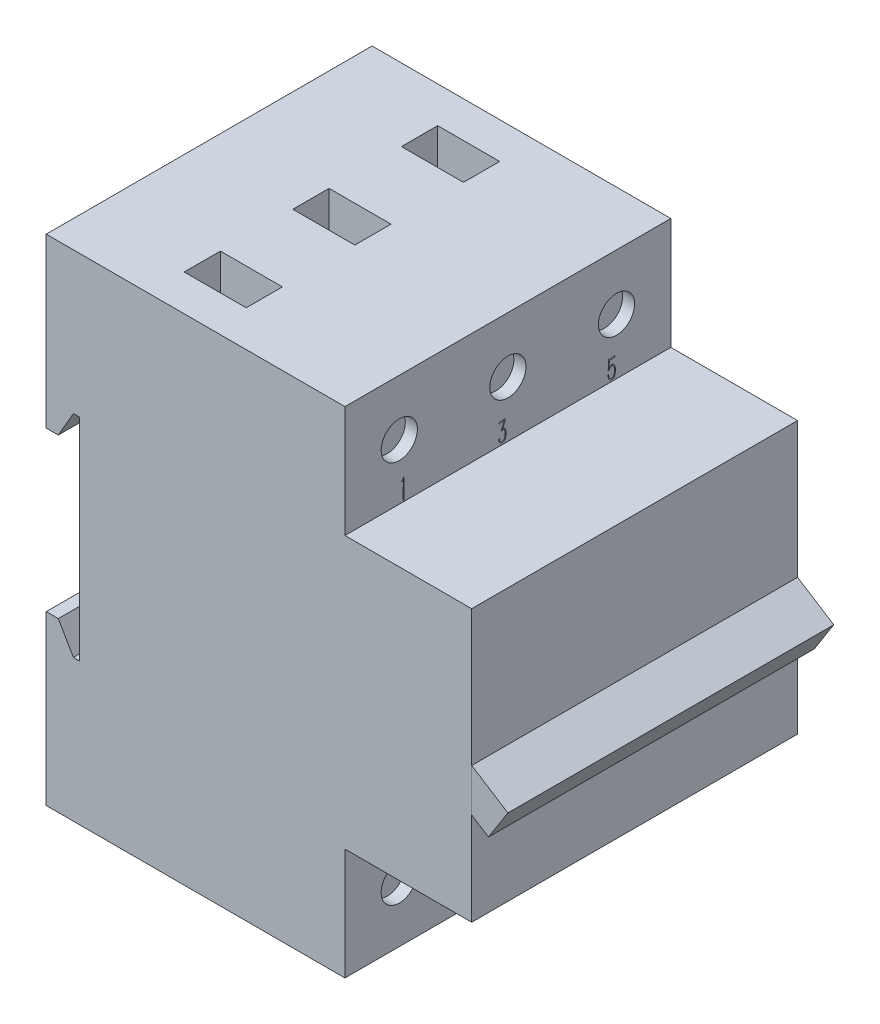
from build123d import *

# Parameters (mm, degrees)
EXTRUDE_1_DEPTH        = 18
SKETCH_2_R             = 3
CUT_EXTRUDE_1_DEPTH    = 2
SKETCH_7_W             = 10.27440821
SKETCH_7_H             = 6
CUT_EXTRUDE_2_DEPTH    = 8
EXTRUDE_3_DEPTH        = 18
PATTERN_LINEAR_1_COUNT = 3
PATTERN_LINEAR_1_PITCH = 18
CUT_EXTRUDE_3_DEPTH    = 1


with BuildPart() as part:
    # 草图1 → 凸台-拉伸1 (new body)
    with BuildSketch(Plane.XY):
        Polygon((0, 13.169872981), (2, 13.169872981), (4.5, 17.5), (5.5, 17.5), (5.5, -17.5), (4.5, -17.5), (2, -13.169872981), (0, -13.169872981), (0, -41), (49.5, -41), (49.5, -22.5), (70.5, -22.5), (70.5, 22.5), (49.5, 22.5), (49.5, 41), (0, 41), align=None)
    extrude(amount=-EXTRUDE_1_DEPTH)

    # 草图2 → 切除-拉伸1 (cut)
    with BuildSketch(Plane(origin=(49.5, 0, 0), x_dir=(0, 0, -1), z_dir=(1, 0, 0))):
        with Locations((9, 31.75)):
            Circle(SKETCH_2_R)
    cut_extrude_1 = extrude(amount=-CUT_EXTRUDE_1_DEPTH, mode=Mode.SUBTRACT)

    # 草图7 → 切除-拉伸2 (cut)
    with BuildSketch(Plane(origin=(0, 41, 0), x_dir=(1, 0, 0), z_dir=(0, 1, 0))):
        with Locations((22, 9)):
            Rectangle(SKETCH_7_W, SKETCH_7_H)
    cut_extrude_2 = extrude(amount=-CUT_EXTRUDE_2_DEPTH, mode=Mode.SUBTRACT)

    # 镜向1: 切除-拉伸1, 切除-拉伸2 across plane
    add(cut_extrude_1.mirror(Plane.ZX), mode=Mode.SUBTRACT)
    add(cut_extrude_2.mirror(Plane.ZX), mode=Mode.SUBTRACT)

    # 草图4 → 凸台-拉伸3 (add, through all)
    with BuildSketch(Plane.XY):
        Polygon((70.5, 0), (76.5, -3.811982778), (73.282472113, -8.876320276), (70.5, -7.10853098), align=None)
    extrude(amount=-EXTRUDE_3_DEPTH)


with BuildPart() as pattern_linear_1_1:
    # 阵列(线性)1: pattern copy
    add(part.part.moved(Location(Vector(0, 0, -1) * (1 * PATTERN_LINEAR_1_PITCH))))


with BuildPart() as pattern_linear_1_2:
    # 阵列(线性)1: pattern copy
    add(part.part.moved(Location(Vector(0, 0, -1) * (2 * PATTERN_LINEAR_1_PITCH))))

    # Combine 1: read off the stored shape, not the designer's step
    # Combine 1: union part, 阵列(线性)1_1
    add(part.part)
    add(pattern_linear_1_1.part)

    # 草图10 → 切除-拉伸3 (cut)
    # profile 1 of 6: a face of its own
    with BuildSketch(Plane(origin=(49.5, 0, 0), x_dir=(0, 0, -1), z_dir=(1, 0, 0))):
        with BuildLine():
            add(Edge.make_bspline(
                [(43.812380141, 25.853079054), (43.824106674, 25.854315631), (43.844424429, 25.856458162), (43.864359748, 25.86089729), (43.872789261, 25.862774345)],
                knots=[0, 0, 0, 0, 1.154313806, 2, 2, 2, 2], degree=3))
            Line((43.872789261, 25.862774345), (43.978691668, 25.867994886))
            Line((43.978691668, 25.867994886), (44.17483486, 25.89782655))
            Line((44.17483486, 25.89782655), (44.341146388, 25.917962924))
            add(Edge.make_bspline(
                [(44.341146388, 25.917962924), (44.356683028, 25.92047472), (44.389335665, 25.925753645), (44.420350321, 25.937278625), (44.436607714, 25.943319838)],
                knots=[0, 0, 0, 0, 0.951631555, 2, 2, 2, 2], degree=3))
            Line((44.436607714, 25.943319838), (44.511932666, 25.973897294))
            add(Edge.make_bspline(
                [(44.511932666, 25.973897294), (44.519683275, 25.976773555), (44.533281517, 25.981819881), (44.550630785, 25.989755389), (44.5631237, 25.994829095), (44.569855105, 25.997515879), (44.572341786, 25.998508417)],
                knots=[0, 0, 0, 0, 1.520021181, 2.666837392, 3.507509911, 4, 4, 4, 4], degree=3))
            Line((44.572341786, 25.998508417), (44.617835074, 26.029085873))
            Line((44.617835074, 26.029085873), (44.764010228, 25.882910718))
            add(Edge.make_bspline(
                [(44.764010228, 25.882910718), (44.769488185, 25.875592833), (44.779078405, 25.862781464), (44.782629447, 25.840840175), (44.77794673, 25.824896631), (44.77260521, 25.810864827), (44.757514621, 25.802411493), (44.745717418, 25.802382554), (44.738653313, 25.802365225)],
                knots=[0, 0, 0, 0, 1.452844315, 2.54348448, 3.406058373, 4.120848162, 4.874773518, 6, 6, 6, 6], degree=3))
            Line((44.738653313, 25.802365225), (43.801939058, 25.671851694))
            Line((43.801939058, 25.671851694), (43.787023226, 24.649371404))
            add(Edge.make_bspline(
                [(43.787023226, 24.649371404), (43.806085069, 24.672548872), (43.84124716, 24.715302777), (43.893506166, 24.776541341), (43.954237846, 24.828564156), (44.016582923, 24.862154614), (44.075039834, 24.885981939), (44.12683362, 24.898111208), (44.184049366, 24.905740422), (44.224029125, 24.906350451), (44.244939271, 24.906669508)],
                knots=[0, 0, 0, 0, 1.30943776, 2.415431215, 3.508265892, 4.775479805, 5.486396256, 6.257089544, 7.088425914, 8, 8, 8, 8], degree=3))
            add(Edge.make_bspline(
                [(44.244939271, 24.906669508), (44.265618247, 24.905329537), (44.304705547, 24.902796731), (44.35920453, 24.893164311), (44.40652664, 24.879600798), (44.46053036, 24.851803695), (44.523628329, 24.803673952), (44.583110152, 24.744842623), (44.629407601, 24.687836143), (44.663541309, 24.638853076), (44.691920047, 24.582820205), (44.718994363, 24.522502055), (44.743113936, 24.456329404), (44.763027731, 24.383723666), (44.779309051, 24.304731749), (44.796037102, 24.188413079), (44.810825274, 24.030970482), (44.812897977, 23.901632104), (44.813978266, 23.83422118)],
                knots=[0, 0, 0, 0, 0.737858689, 1.39469691, 1.969129469, 2.484137971, 3.548991738, 4.782985237, 5.456749125, 6.164369648, 6.905359031, 7.690566505, 8.520047268, 9.411980184, 10.370982938, 11.392008999, 13.598323608, 16, 16, 16, 16], degree=3))
            add(Edge.make_bspline(
                [(44.813978266, 23.83422118), (44.812772137, 23.80414015), (44.810438998, 23.745951333), (44.806456399, 23.661598278), (44.799561788, 23.583284286), (44.78894857, 23.489110778), (44.772504699, 23.381232336), (44.743628379, 23.261586384), (44.703857376, 23.151338515), (44.650731531, 23.052061618), (44.590620679, 22.965347572), (44.526285945, 22.896048271), (44.459883006, 22.845650844), (44.389137035, 22.813904085), (44.311900791, 22.799722227), (44.258410697, 22.79782952), (44.230023439, 22.796825059)],
                knots=[0, 0, 0, 0, 0.953497838, 1.844448518, 2.674189816, 3.442807412, 4.845957472, 6.127295929, 7.335424679, 8.547012004, 9.682888764, 10.668703604, 11.530079681, 12.305522429, 13.100738679, 14, 14, 14, 14], degree=3))
            add(Edge.make_bspline(
                [(44.230023439, 22.796825059), (44.195962079, 22.796236308), (44.132788167, 22.795144347), (44.041988795, 22.806001227), (43.959621992, 22.835808698), (43.881287848, 22.881328515), (43.808090276, 22.945454086), (43.74505042, 23.023998451), (43.694747655, 23.108903944), (43.658311007, 23.197503968), (43.636013852, 23.293158909), (43.616997815, 23.397308655), (43.604251554, 23.507519245), (43.605291338, 23.581866497), (43.605795866, 23.617941615)],
                knots=[0, 0, 0, 0, 1.038316962, 1.925775792, 2.769505923, 3.689817589, 4.672983852, 5.718137725, 6.747565775, 7.672204827, 8.626195073, 9.735182009, 10.901054531, 12, 12, 12, 12], degree=3))
            Line((43.605795866, 23.617941615), (43.611016407, 23.758896228))
            Line((43.611016407, 23.758896228), (43.666204986, 23.758896228))
            add(Edge.make_bspline(
                [(43.666204986, 23.758896228), (43.66850247, 23.73078902), (43.673045707, 23.675207472), (43.683201612, 23.591913184), (43.699714698, 23.507379032), (43.719836499, 23.421851972), (43.746302571, 23.341167369), (43.774489791, 23.266706141), (43.814799029, 23.198939277), (43.863792061, 23.131159375), (43.926863546, 23.068596197), (43.989706419, 23.025248686), (44.047192571, 23.000513156), (44.096313943, 22.986947363), (44.15126968, 22.97999511), (44.189733551, 22.978720344), (44.209887066, 22.978052418)],
                knots=[0, 0, 0, 0, 1.11825376, 2.211328589, 3.324923754, 4.532299777, 5.691974021, 6.691431964, 7.680579644, 8.808308283, 10.000254076, 11.186807161, 11.80939407, 12.474247533, 13.200567339, 14, 14, 14, 14], degree=3))
            add(Edge.make_bspline(
                [(44.209887066, 22.978052418), (44.233567678, 22.978149553), (44.281349484, 22.978345548), (44.341390498, 22.992595379), (44.388661819, 23.015064168), (44.425299747, 23.041407242), (44.463571245, 23.074883356), (44.500528477, 23.117327484), (44.536545117, 23.164524764), (44.568293785, 23.216268124), (44.593677268, 23.271983402), (44.620438514, 23.352210268), (44.645301827, 23.460885822), (44.66809731, 23.600794455), (44.679968479, 23.753723966), (44.678832604, 23.859811044), (44.678244193, 23.914766674)],
                knots=[0, 0, 0, 0, 0.849390509, 1.713866746, 2.18933602, 2.722107664, 3.329685584, 4.012931591, 4.740083059, 5.461671267, 6.189151886, 6.934940173, 8.497098365, 10.188936476, 12.025778447, 14, 14, 14, 14], degree=3))
            add(Edge.make_bspline(
                [(44.678244193, 23.914766674), (44.676571297, 23.946860946), (44.673376088, 24.008160572), (44.663842606, 24.095614491), (44.654073423, 24.174352142), (44.637197631, 24.266416244), (44.609824527, 24.371708387), (44.570633873, 24.469390278), (44.532708509, 24.5399153), (44.501627464, 24.586702873), (44.466088301, 24.626669556), (44.427351982, 24.660478714), (44.38530426, 24.687431906), (44.34101946, 24.70798623), (44.293849493, 24.721018287), (44.261424071, 24.723951121), (44.244939271, 24.725442148)],
                knots=[0, 0, 0, 0, 1.343436322, 2.565945237, 3.677305729, 4.659990038, 6.477828082, 8.216935171, 9.044830502, 9.823221578, 10.559528994, 11.274319052, 11.966299338, 12.640726254, 13.308957145, 14, 14, 14, 14], degree=3))
            add(Edge.make_bspline(
                [(44.244939271, 24.725442148), (44.227004165, 24.724893209), (44.192139975, 24.723826121), (44.141362399, 24.714811462), (44.094322931, 24.699035092), (44.03800593, 24.671356195), (43.976300058, 24.630521421), (43.916328615, 24.574585654), (43.869360399, 24.517916248), (43.847849274, 24.477464717), (43.837737055, 24.458448753)],
                knots=[0, 0, 0, 0, 0.840347904, 1.633558669, 2.40744423, 3.157989381, 4.570423979, 5.856859538, 6.992525654, 8, 8, 8, 8], degree=3))
            Line((43.837737055, 24.458448753), (43.801939058, 24.387598551))
            Line((43.801939058, 24.387598551), (43.792243767, 24.322714681))
            add(Edge.make_bspline(
                [(43.792243767, 24.322714681), (43.791670649, 24.313802638), (43.7906645, 24.298156949), (43.787272405, 24.277314507), (43.785212756, 24.26446721), (43.783468687, 24.252834572), (43.771962065, 24.254246791), (43.760799163, 24.264707586), (43.740872224, 24.280779878), (43.725767158, 24.29452601), (43.716918815, 24.302578308)],
                knots=[0, 0, 0, 0, 1.417361355, 2.488272572, 3.242975776, 3.665551287, 3.979432497, 4.77388376, 6.110184861, 8, 8, 8, 8], degree=3))
            Line((43.716918815, 24.302578308), (43.611016407, 24.387598551))
            add(Edge.make_bspline(
                [(43.611016407, 24.387598551), (43.601939435, 24.395854264), (43.58784923, 24.408669626), (43.572368991, 24.432942631), (43.583887199, 24.458583701), (43.594123108, 24.474053968), (43.600575325, 24.483805668)],
                knots=[0, 0, 0, 0, 1.303116375, 2.022830373, 2.753688992, 4, 4, 4, 4], degree=3))
            Line((43.600575325, 24.483805668), (43.656509695, 24.55913062))
            Line((43.656509695, 24.55913062), (43.666204986, 25.097592159))
            Line((43.666204986, 25.097592159), (43.671425527, 25.485403793))
            add(Edge.make_bspline(
                [(43.671425527, 25.485403793), (43.67142611, 25.499822442), (43.671427365, 25.530897116), (43.671416389, 25.580616346), (43.671465956, 25.636551667), (43.671259895, 25.695713846), (43.671973246, 25.75266383), (43.669949272, 25.801119108), (43.669028886, 25.838464529), (43.667036512, 25.859299376), (43.666204986, 25.867994886)],
                knots=[0, 0, 0, 0, 0.904131945, 1.948560225, 3.117696361, 4.41154035, 5.658618894, 6.687930963, 7.452402571, 8, 8, 8, 8], degree=3))
            Line((43.666204986, 25.867994886), (43.646068613, 26.023865331))
            Line((43.646068613, 26.023865331), (43.696782442, 26.044001705))
            add(Edge.make_bspline(
                [(43.696782442, 26.044001705), (43.704169024, 26.025347291), (43.716588328, 25.993983012), (43.734028059, 25.952094926), (43.756014192, 25.920605528), (43.772844159, 25.902819327), (43.781802685, 25.893351801)],
                knots=[0, 0, 0, 0, 1.37928148, 2.31903137, 3.105226912, 4, 4, 4, 4], degree=3))
            Line((43.781802685, 25.893351801), (43.812380141, 25.853079054))
        make_face()
    # profile 2 of 6: a face of its own
    with BuildSketch(Plane(origin=(49.5, 0, 0), x_dir=(0, 0, -1), z_dir=(1, 0, 0))):
        with BuildLine():
            add(Edge.make_bspline(
                [(25.98199446, 24.810462391), (25.993166094, 24.833589435), (26.014686786, 24.878140663), (26.046076735, 24.942493606), (26.075360697, 25.001577682), (26.100407321, 25.056404139), (26.123762159, 25.105764243), (26.144562667, 25.15018641), (26.162535707, 25.189685164), (26.181457522, 25.233537238), (26.201082334, 25.279285126), (26.2200808, 25.324094015), (26.233896709, 25.356102037), (26.241039562, 25.373034953), (26.243767313, 25.379501385)],
                knots=[0, 0, 0, 0, 1.475873638, 2.843077615, 4.114458223, 5.26483622, 6.306479236, 7.252326145, 8.083448402, 8.799989154, 9.996708352, 10.943956596, 11.596712522, 12, 12, 12, 12], degree=3))
            Line((26.243767313, 25.379501385), (26.4048583, 25.807585766))
            add(Edge.make_bspline(
                [(26.4048583, 25.807585766), (26.369822143, 25.804157075), (26.293374976, 25.796675841), (26.195814919, 25.790735725), (26.114697228, 25.786409905), (26.059036622, 25.781745782), (26.010296814, 25.777386359), (25.980249824, 25.774069735), (25.966332836, 25.772533561)],
                knots=[0, 0, 0, 0, 1.440114021, 3.142257811, 3.998086789, 4.76330671, 5.427195687, 6, 6, 6, 6], degree=3))
            Line((25.966332836, 25.772533561), (25.815682932, 25.747176646))
            add(Edge.make_bspline(
                [(25.815682932, 25.747176646), (25.808951487, 25.745761471), (25.790586266, 25.741900485), (25.756623302, 25.731357329), (25.707710362, 25.718391681), (25.670480946, 25.707729147), (25.649371404, 25.701683358)],
                knots=[0, 0, 0, 0, 0.478461291, 1.305373098, 2.472113022, 4, 4, 4, 4], degree=3))
            Line((25.649371404, 25.701683358), (25.599403367, 25.681546985))
            Line((25.599403367, 25.681546985), (25.473364586, 25.867994886))
            add(Edge.make_bspline(
                [(25.473364586, 25.867994886), (25.468042388, 25.875294714), (25.458956828, 25.8877563), (25.451414195, 25.905091621), (25.445815397, 25.917134887), (25.450833433, 25.929262471), (25.470676222, 25.927443918), (25.485657829, 25.91680722), (25.504793529, 25.90657335), (25.526809581, 25.905134019), (25.553500832, 25.903567608), (25.57306318, 25.906607977), (25.583741743, 25.908267633)],
                knots=[0, 0, 0, 0, 1.323589942, 2.259509366, 2.829398404, 3.190947808, 3.965341466, 5.19662492, 6.050472624, 7.088782, 8.410843841, 10, 10, 10, 10], degree=3))
            Line((25.583741743, 25.908267633), (25.74483273, 25.913488174))
            Line((25.74483273, 25.913488174), (26.379501385, 25.988813126))
            Line((26.379501385, 25.988813126), (26.429469423, 26.034306414))
            Line((26.429469423, 26.034306414), (26.469742169, 26.07457916))
            add(Edge.make_bspline(
                [(26.469742169, 26.07457916), (26.470991145, 26.073092428), (26.476111254, 26.066997649), (26.48713393, 26.052494818), (26.506733792, 26.029194078), (26.52155216, 26.009776485), (26.530151289, 25.998508417)],
                knots=[0, 0, 0, 0, 0.23984028, 0.983211964, 2.249351781, 4, 4, 4, 4], degree=3))
            Line((26.530151289, 25.998508417), (26.626358406, 25.877690177))
            add(Edge.make_bspline(
                [(26.626358406, 25.877690177), (26.632818866, 25.869302134), (26.643555126, 25.855362537), (26.651520152, 25.833069109), (26.643358437, 25.817964796), (26.631957014, 25.805017661), (26.613475245, 25.789467159), (26.598832043, 25.77864613), (26.590560409, 25.772533561)],
                knots=[0, 0, 0, 0, 1.419029252, 2.358201718, 2.827787952, 3.596253847, 4.642174893, 6, 6, 6, 6], degree=3))
            Line((26.590560409, 25.772533561), (26.53537183, 25.727040273))
            add(Edge.make_bspline(
                [(26.53537183, 25.727040273), (26.519243296, 25.686506975), (26.488641666, 25.609600733), (26.444550781, 25.500149867), (26.40420582, 25.402832313), (26.368780149, 25.31679816), (26.336241172, 25.243025268), (26.309378323, 25.180427165), (26.285193017, 25.13020579), (26.270400017, 25.10080722), (26.263903686, 25.087896868)],
                knots=[0, 0, 0, 0, 1.507300768, 2.859891598, 4.076963614, 5.147345159, 6.074452096, 6.862861548, 7.500626815, 8, 8, 8, 8], degree=3))
            Line((26.263903686, 25.087896868), (26.112507991, 24.8007671))
            add(Edge.make_bspline(
                [(26.112507991, 24.8007671), (26.130403449, 24.802195946), (26.164676409, 24.804932439), (26.216981179, 24.81015627), (26.273970232, 24.802970936), (26.323954561, 24.782980329), (26.366482501, 24.75831345), (26.400560146, 24.733676087), (26.433116197, 24.70165441), (26.466313362, 24.664010589), (26.499588074, 24.619080736), (26.530176007, 24.564661457), (26.562017654, 24.502519508), (26.601839302, 24.407816173), (26.644868289, 24.281101178), (26.671012002, 24.121946436), (26.683928997, 23.962489754), (26.685825305, 23.856371069), (26.686767526, 23.803643725)],
                knots=[0, 0, 0, 0, 0.660541429, 1.265053373, 1.928435853, 2.750244091, 3.225390118, 3.735570922, 4.291687282, 4.900607759, 5.580848831, 6.342918567, 7.193367346, 8.147740655, 10.119512469, 12.097611575, 14.061014616, 16, 16, 16, 16], degree=3))
            add(Edge.make_bspline(
                [(26.686767526, 23.803643725), (26.684777164, 23.762363845), (26.680996115, 23.683945329), (26.671858215, 23.573133948), (26.658221803, 23.475918021), (26.638362701, 23.366315493), (26.603339721, 23.245226268), (26.560073273, 23.133510275), (26.518992434, 23.053025261), (26.484370419, 22.999656143), (26.446449436, 22.951910647), (26.405698395, 22.910128162), (26.363308904, 22.875791728), (26.322167965, 22.846261269), (26.280537511, 22.8253901), (26.226643161, 22.807954302), (26.160782978, 22.795935699), (26.108328175, 22.793527826), (26.082676326, 22.792350309)],
                knots=[0, 0, 0, 0, 1.512752116, 2.8737433, 4.067977017, 5.104892351, 6.948544146, 8.672095895, 9.482011449, 10.251829035, 10.996496654, 11.710742831, 12.38300564, 12.991319199, 13.561044299, 14.079002633, 15.060579187, 16, 16, 16, 16], degree=3))
            add(Edge.make_bspline(
                [(26.082676326, 22.792350309), (26.060796391, 22.791977356), (26.018701906, 22.791259836), (25.95764496, 22.796230338), (25.902035506, 22.807606906), (25.849883073, 22.823082986), (25.801040629, 22.847556614), (25.754386649, 22.8825171), (25.707421049, 22.925566915), (25.662390439, 22.978396905), (25.621177812, 23.038922579), (25.585142575, 23.105872242), (25.555202255, 23.178298085), (25.5254378, 23.281370017), (25.500209901, 23.413168693), (25.495715482, 23.519872451), (25.493500959, 23.572448327)],
                knots=[0, 0, 0, 0, 0.828828519, 1.594571005, 2.314948186, 2.97625877, 3.650192192, 4.371738268, 5.178272596, 6.059897072, 6.995131469, 7.947518938, 8.935744196, 9.957858231, 12.008325587, 14, 14, 14, 14], degree=3))
            Line((25.493500959, 23.572448327), (25.488280418, 23.768591519))
            Line((25.488280418, 23.768591519), (25.543468996, 23.768591519))
            add(Edge.make_bspline(
                [(25.543468996, 23.768591519), (25.547689194, 23.739505045), (25.555771247, 23.683801866), (25.567527521, 23.603436334), (25.579703834, 23.530177708), (25.593426196, 23.443483121), (25.616280353, 23.34613445), (25.654782638, 23.241361869), (25.70699713, 23.152835647), (25.768303372, 23.079883965), (25.840004675, 23.026931873), (25.916762107, 22.993530791), (25.994991786, 22.977760235), (26.046824011, 22.977956297), (26.072235244, 22.978052418)],
                knots=[0, 0, 0, 0, 0.994021113, 1.903638599, 2.746793397, 3.505624798, 4.871908371, 6.122639036, 7.264652637, 8.331625701, 9.323760524, 10.250011688, 11.142051883, 12, 12, 12, 12], degree=3))
            add(Edge.make_bspline(
                [(26.072235244, 22.978052418), (26.092678199, 22.979815268), (26.132717443, 22.983267958), (26.190778694, 22.99641271), (26.244473671, 23.018841707), (26.294667803, 23.04752351), (26.339847529, 23.084925568), (26.380509526, 23.128997405), (26.414945037, 23.181353691), (26.453537544, 23.261508139), (26.491043538, 23.372011634), (26.519263819, 23.512370412), (26.537627218, 23.655540092), (26.546254243, 23.797993223), (26.54742972, 23.938334289), (26.535889833, 24.030183148), (26.530151289, 24.07585766)],
                knots=[0, 0, 0, 0, 0.647840119, 1.268849254, 1.871153999, 2.479976942, 3.088343857, 3.716462885, 4.367721208, 5.059616847, 6.52246665, 8.039623249, 9.575767262, 11.078710543, 12.547304005, 14, 14, 14, 14], degree=3))
            add(Edge.make_bspline(
                [(26.530151289, 24.07585766), (26.522127107, 24.125088053), (26.506265147, 24.222405208), (26.469573371, 24.339214311), (26.433442204, 24.426438384), (26.40120693, 24.484958794), (26.364669655, 24.537231368), (26.323282219, 24.581073147), (26.281326968, 24.617050157), (26.239215086, 24.641056719), (26.197627381, 24.653409977), (26.170978929, 24.650694047), (26.158001278, 24.649371404)],
                knots=[0, 0, 0, 0, 2.019199264, 3.991492233, 4.943861116, 5.841091039, 6.693606335, 7.520378909, 8.278781735, 8.923571305, 9.475785111, 10, 10, 10, 10], degree=3))
            Line((26.158001278, 24.649371404), (26.077455785, 24.639676113))
            Line((26.077455785, 24.639676113), (26.04240358, 24.574046452))
            add(Edge.make_bspline(
                [(26.04240358, 24.574046452), (26.037725054, 24.565867362), (26.029569236, 24.5516092), (26.018424398, 24.532763121), (26.009523154, 24.521724539), (26.002766908, 24.51220847), (25.993000193, 24.515409688), (25.986718225, 24.526348658), (25.97667592, 24.542452355), (25.970143493, 24.556283081), (25.966332836, 24.564351161)],
                knots=[0, 0, 0, 0, 1.659028505, 2.892093886, 3.763458346, 4.288089223, 4.647361994, 5.327919393, 6.441255868, 8, 8, 8, 8], degree=3))
            Line((25.966332836, 24.564351161), (25.885787343, 24.720221607))
            add(Edge.make_bspline(
                [(25.885787343, 24.720221607), (25.879965358, 24.729180034), (25.869815978, 24.744797127), (25.874216009, 24.762599317), (25.876092052, 24.770189644)],
                knots=[0, 0, 0, 0, 1.147259222, 2, 2, 2, 2], degree=3))
            Line((25.876092052, 24.770189644), (25.916364799, 24.785851268))
            Line((25.916364799, 24.785851268), (25.98199446, 24.810462391))
        make_face()
    # profile 3 of 6: a face of its own
    with BuildSketch(Plane(origin=(49.5, 0, 0), x_dir=(0, 0, -1), z_dir=(1, 0, 0))):
        with BuildLine():
            Line((9.753569146, 26.034306414), (9.808757724, 26.034306414))
            Line((9.808757724, 26.034306414), (9.803537183, 23.360643512))
            add(Edge.make_bspline(
                [(9.803537183, 23.360643512), (9.802942466, 23.336531223), (9.801802161, 23.290298592), (9.801709616, 23.224151689), (9.799534204, 23.164261802), (9.799360932, 23.110543188), (9.797743331, 23.063066024), (9.795872731, 23.021820374), (9.795694988, 22.986728926), (9.792386231, 22.931806279), (9.788443409, 22.856291737), (9.778665414, 22.778513041), (9.770881394, 22.723092466), (9.762968296, 22.697864051), (9.752943214, 22.677902503), (9.742938201, 22.680230387), (9.738653313, 22.68122736)],
                knots=[0, 0, 0, 0, 1.45038606, 2.780953852, 3.977268029, 5.053718292, 6.010937745, 6.833690271, 7.536464333, 8.120251454, 10.142880859, 12.069479857, 12.873132744, 13.440417135, 13.76034519, 14, 14, 14, 14], degree=3))
            add(Edge.make_bspline(
                [(9.738653313, 22.68122736), (9.737662784, 22.681977123), (9.733423077, 22.68518629), (9.72331255, 22.691978917), (9.711299159, 22.710186957), (9.706040447, 22.726522015), (9.702855316, 22.736415939)],
                knots=[0, 0, 0, 0, 0.221265066, 0.947068446, 2.150880552, 4, 4, 4, 4], degree=3))
            Line((9.702855316, 22.736415939), (9.678244193, 22.8020456))
            Line((9.678244193, 22.8020456), (9.622309823, 22.98327296))
            add(Edge.make_bspline(
                [(9.622309823, 22.98327296), (9.615576531, 23.000324587), (9.603847485, 23.030027641), (9.592015465, 23.069106135), (9.583039296, 23.094059404), (9.580653503, 23.114285114), (9.592145881, 23.133256883), (9.600609622, 23.162467624), (9.61363306, 23.199753211), (9.625931645, 23.243760308), (9.636794197, 23.291309282), (9.646579462, 23.342684453), (9.652125052, 23.400567186), (9.65484538, 23.455833044), (9.65693307, 23.509042479), (9.657312371, 23.560268342), (9.658358534, 23.620921331), (9.658195104, 23.664677216), (9.65810782, 23.688046026)],
                knots=[0, 0, 0, 0, 1.220359697, 2.125803599, 2.712350858, 2.994193817, 3.439826662, 4.12562012, 5.031064022, 6.063176816, 7.167225426, 8.277459231, 9.542238136, 11.034069985, 11.961482632, 13.08703073, 14.444263491, 16, 16, 16, 16], degree=3))
            Line((9.65810782, 23.688046026), (9.66258257, 25.661410612))
            Line((9.66258257, 25.661410612), (9.400809717, 25.434689964))
            Line((9.400809717, 25.434689964), (9.380673343, 25.520455998))
            add(Edge.make_bspline(
                [(9.380673343, 25.520455998), (9.401951782, 25.542443117), (9.441839093, 25.583658879), (9.495146222, 25.643002168), (9.53898947, 25.694502744), (9.584655139, 25.754709329), (9.635783064, 25.82963605), (9.673539424, 25.89119403), (9.693160026, 25.923183465)],
                knots=[0, 0, 0, 0, 1.077185482, 2.019228619, 2.808185376, 3.45765616, 4.678836699, 6, 6, 6, 6], degree=3))
            Line((9.693160026, 25.923183465), (9.753569146, 26.034306414))
        make_face()
    # profile 4 of 6: a face of its own
    with BuildSketch(Plane(origin=(49.5, 0, 0), x_dir=(0, 0, -1), z_dir=(1, 0, 0))):
        with BuildLine():
            Line((7.871872543, -24.264862561), (7.7958018, -24.264862561))
            add(Edge.make_bspline(
                [(7.7958018, -24.264862561), (7.794234396, -24.240753306), (7.791246264, -24.19479092), (7.788162921, -24.129151646), (7.786860809, -24.070215602), (7.785556392, -23.99836566), (7.787568131, -23.907753799), (7.792969819, -23.83476945), (7.7958018, -23.796505434)],
                knots=[0, 0, 0, 0, 0.927540379, 1.768282303, 2.522502339, 3.190652681, 4.527123766, 6, 6, 6, 6], degree=3))
            add(Edge.make_bspline(
                [(7.7958018, -23.796505434), (7.797761707, -23.768139156), (7.801551943, -23.713282026), (7.811554947, -23.63421952), (7.823131454, -23.560955145), (7.838182009, -23.49204459), (7.858517789, -23.42460873), (7.887467972, -23.356779876), (7.923574304, -23.286234811), (7.966232975, -23.215442866), (8.013039613, -23.148644983), (8.065578121, -23.094287734), (8.120563941, -23.052856537), (8.179067549, -23.028198661), (8.235239487, -23.01286498), (8.286463693, -23.000803406), (8.332495272, -22.992373995), (8.361578003, -22.991474395), (8.375281876, -22.991050501)],
                knots=[0, 0, 0, 0, 1.238521709, 2.395159043, 3.470603583, 4.46912877, 5.466066804, 6.534123646, 7.677244524, 8.916145015, 10.13365226, 11.221244199, 12.198275335, 13.109907183, 13.966820176, 14.733954848, 15.403435577, 16, 16, 16, 16], degree=3))
            add(Edge.make_bspline(
                [(8.375281876, -22.991050501), (8.392746072, -22.992338183), (8.427254782, -22.994882602), (8.478016138, -23.006671597), (8.527041189, -23.023669567), (8.589745884, -23.053949588), (8.663068931, -23.101424485), (8.72544731, -23.163766889), (8.768611377, -23.220833206), (8.79901623, -23.269401053), (8.825959727, -23.323633808), (8.85979583, -23.402435847), (8.895193099, -23.50700687), (8.920719801, -23.639080796), (8.937086892, -23.776233689), (8.944575358, -23.91644525), (8.945967758, -24.055274867), (8.937816025, -24.145817291), (8.933879788, -24.189537609)],
                knots=[0, 0, 0, 0, 0.570779476, 1.127842599, 1.694919432, 2.261066821, 3.397481896, 4.527710891, 5.118384485, 5.730727279, 6.394748858, 7.092559246, 8.529363642, 9.986910621, 11.474321506, 13.03467297, 14.568129345, 16, 16, 16, 16], degree=3))
            add(Edge.make_bspline(
                [(8.933879788, -24.189537609), (8.925900414, -24.234509857), (8.909822611, -24.325125345), (8.875192925, -24.434225144), (8.842896816, -24.517169107), (8.815895575, -24.572750012), (8.787045015, -24.6219546), (8.745327278, -24.6801439), (8.681618845, -24.746195261), (8.622582587, -24.790490068), (8.591561442, -24.813765182)],
                knots=[0, 0, 0, 0, 1.490916612, 3.004077927, 3.729534125, 4.397912905, 5.020560084, 5.590839424, 6.734084393, 8, 8, 8, 8], degree=3))
            Line((8.591561442, -24.813765182), (8.344704421, -24.969635628))
            add(Edge.make_bspline(
                [(8.344704421, -24.969635628), (8.313247417, -24.990991392), (8.253598933, -25.031485997), (8.173951741, -25.097632031), (8.10710124, -25.167328115), (8.056572146, -25.244391364), (8.017327234, -25.323717163), (7.982479002, -25.40336802), (7.956170358, -25.491161597), (7.937458627, -25.569853451), (7.924697846, -25.63594277), (7.918305716, -25.682034871), (7.913112975, -25.722771633), (7.912454362, -25.748228452), (7.91214529, -25.760174728)],
                knots=[0, 0, 0, 0, 1.453572249, 2.75625039, 3.953730064, 5.132566341, 6.263730064, 7.337486329, 8.453238547, 9.76321854, 10.430854957, 11.026567013, 11.543191201, 12, 12, 12, 12], degree=3))
            Line((7.91214529, -25.760174728), (7.901704208, -25.971233752))
            Line((7.901704208, -25.971233752), (8.802620466, -25.941402088))
            add(Edge.make_bspline(
                [(8.802620466, -25.941402088), (8.814180744, -25.940755724), (8.834485185, -25.939620451), (8.853998999, -25.918347064), (8.858342549, -25.892372243), (8.866049907, -25.860423962), (8.8717798, -25.81462895), (8.876200012, -25.779802597), (8.87869121, -25.760174728)],
                knots=[0, 0, 0, 0, 0.925905201, 1.626257371, 2.181371879, 3.087088273, 4.358305093, 6, 6, 6, 6], degree=3))
            Line((8.87869121, -25.760174728), (8.898827583, -25.321649265))
            Line((8.898827583, -25.321649265), (8.968931994, -25.321649265))
            Line((8.968931994, -25.321649265), (8.994288908, -25.986149584))
            add(Edge.make_bspline(
                [(8.994288908, -25.986149584), (8.995136604, -25.999068195), (8.996619224, -26.021662858), (8.997340943, -26.051552331), (8.997361371, -26.072364854), (8.997046602, -26.089168854), (8.991634412, -26.103860909), (8.986605399, -26.120908527), (8.966987691, -26.130539629), (8.938788628, -26.133621158), (8.895932324, -26.137985434), (8.862296475, -26.137706301), (8.842893213, -26.13754528)],
                knots=[0, 0, 0, 0, 1.385018147, 2.4223982, 3.193529914, 3.619812046, 4.200562765, 4.878496499, 5.402948042, 6.404258339, 7.925751149, 10, 10, 10, 10], degree=3))
            Line((8.842893213, -26.13754528), (7.841295088, -26.162902195))
            add(Edge.make_bspline(
                [(7.841295088, -26.162902195), (7.829119648, -26.162937814), (7.805120958, -26.163008021), (7.780527965, -26.139144046), (7.770204333, -26.109929903), (7.765037396, -26.075568207), (7.761576459, -26.029981614), (7.759914038, -25.951575476), (7.763468241, -25.840015589), (7.771473981, -25.747961164), (7.775665426, -25.699765608)],
                knots=[0, 0, 0, 0, 0.556373901, 1.096654043, 1.476064089, 2.012759395, 2.73145082, 3.635924119, 5.715166189, 8, 8, 8, 8], degree=3))
            add(Edge.make_bspline(
                [(7.775665426, -25.699765608), (7.779384986, -25.671633927), (7.78655015, -25.617442544), (7.801118605, -25.539436814), (7.816650941, -25.467030035), (7.833507624, -25.400266013), (7.852116573, -25.339496475), (7.872428189, -25.284790992), (7.89348431, -25.235268508), (7.925111695, -25.17924562), (7.965307639, -25.118178785), (8.011028319, -25.052334036), (8.055048429, -24.996480007), (8.112584858, -24.935031572), (8.190478168, -24.867959994), (8.255913503, -24.818848521), (8.289515842, -24.793628809)],
                knots=[0, 0, 0, 0, 1.103491021, 2.125706759, 3.085324024, 3.98349739, 4.803138144, 5.555704107, 6.252741852, 6.89323317, 8.054555834, 9.09539633, 10.010480884, 10.817709087, 12.365830683, 14, 14, 14, 14], degree=3))
            Line((8.289515842, -24.793628809), (8.496100116, -24.662369486))
            add(Edge.make_bspline(
                [(8.496100116, -24.662369486), (8.512639398, -24.651373167), (8.544378076, -24.630271365), (8.588215931, -24.596675584), (8.625589346, -24.561817573), (8.657796538, -24.524201226), (8.686952092, -24.480673778), (8.710896401, -24.426417496), (8.736209879, -24.362508819), (8.76572399, -24.263078861), (8.79615517, -24.131840057), (8.807820786, -23.969689346), (8.801588909, -23.805435751), (8.782536885, -23.696415737), (8.772788802, -23.640634988)],
                knots=[0, 0, 0, 0, 0.635613896, 1.219735276, 1.765761318, 2.268061313, 2.802129131, 3.435697723, 4.161225462, 5.001884758, 6.75303811, 8.46119913, 10.189351173, 12, 12, 12, 12], degree=3))
            add(Edge.make_bspline(
                [(8.772788802, -23.640634988), (8.765443456, -23.612197988), (8.751117592, -23.556736394), (8.724002852, -23.476841805), (8.688904482, -23.404075735), (8.651336965, -23.33610105), (8.604271968, -23.276599716), (8.541580683, -23.233865922), (8.467519435, -23.205299367), (8.413345499, -23.200268961), (8.384977167, -23.197634775)],
                knots=[0, 0, 0, 0, 1.101106684, 2.147523679, 3.156537618, 4.125318695, 5.058520457, 5.968677808, 6.93629249, 8, 8, 8, 8], degree=3))
            add(Edge.make_bspline(
                [(8.384977167, -23.197634775), (8.370044771, -23.197481899), (8.340261061, -23.197176976), (8.295899539, -23.203904277), (8.252751847, -23.218009595), (8.19607343, -23.243574701), (8.130580381, -23.291195576), (8.061644019, -23.36304645), (8.004782482, -23.450777932), (7.961003454, -23.552442718), (7.928084884, -23.668266624), (7.90136145, -23.798073758), (7.883814072, -23.943510229), (7.878911635, -24.04530483), (7.876347293, -24.098551033)],
                knots=[0, 0, 0, 0, 0.469335518, 0.936122588, 1.403629858, 1.893624907, 2.887406355, 3.927357629, 5.011993806, 6.157121359, 7.396943717, 8.794309501, 10.323183677, 12, 12, 12, 12], degree=3))
            Line((7.876347293, -24.098551033), (7.871872543, -24.264862561))
        make_face()
    # profile 5 of 6: a face of its own
    with BuildSketch(Plane(origin=(49.5, 0, 0), x_dir=(0, 0, -1), z_dir=(1, 0, 0))):
        with BuildLine():
            Line((26.15572473, -25.226187939), (25.445731122, -25.266460686))
            Line((25.445731122, -25.266460686), (25.395763085, -25.341785638))
            add(Edge.make_bspline(
                [(25.395763085, -25.341785638), (25.392502387, -25.349679137), (25.387574463, -25.361608661), (25.369354675, -25.373911461), (25.355686212, -25.356264142), (25.349227289, -25.344755436), (25.345049256, -25.337310889)],
                knots=[0, 0, 0, 0, 1.282902353, 1.938863145, 2.666728425, 4, 4, 4, 4], degree=3))
            Line((25.345049256, -25.337310889), (25.24958793, -25.145642446))
            add(Edge.make_bspline(
                [(25.24958793, -25.145642446), (25.245504141, -25.134324094), (25.238770014, -25.115660249), (25.233867321, -25.090608831), (25.235261286, -25.072940484), (25.238496738, -25.063813956), (25.239892639, -25.059876412)],
                knots=[0, 0, 0, 0, 1.63130738, 2.690008936, 3.434818089, 4, 4, 4, 4], degree=3))
            Line((25.239892639, -25.059876412), (25.280165386, -25.050181121))
            Line((25.280165386, -25.050181121), (25.335353965, -25.019603665))
            Line((25.335353965, -25.019603665), (26.186302185, -22.965693586))
            Line((26.186302185, -22.965693586), (26.296679343, -22.965693586))
            Line((26.296679343, -22.965693586), (26.296679343, -25.039740038))
            add(Edge.make_bspline(
                [(26.296679343, -25.039740038), (26.307050889, -25.039818671), (26.324686461, -25.039952376), (26.340768883, -25.032935126), (26.347393172, -25.030044747)],
                knots=[0, 0, 0, 0, 1.176207474, 2, 2, 2, 2], degree=3))
            Line((26.347393172, -25.030044747), (26.422718124, -24.999467292))
            add(Edge.make_bspline(
                [(26.422718124, -24.999467292), (26.432455769, -24.995832951), (26.449812812, -24.989354853), (26.472162249, -24.979625936), (26.48798351, -24.97213511), (26.495355465, -24.966477643), (26.498043076, -24.964415086)],
                knots=[0, 0, 0, 0, 1.495147538, 2.665053038, 3.513315187, 4, 4, 4, 4], degree=3))
            Line((26.498043076, -24.964415086), (26.533095282, -24.934583422))
            Line((26.533095282, -24.934583422), (26.674049895, -25.080012785))
            add(Edge.make_bspline(
                [(26.674049895, -25.080012785), (26.681230642, -25.08865431), (26.692985232, -25.102800135), (26.698115613, -25.126739108), (26.693223041, -25.142928321), (26.684077007, -25.15458685), (26.668134536, -25.159473801), (26.656399655, -25.160154501), (26.649438772, -25.160558278)],
                knots=[0, 0, 0, 0, 1.690587597, 2.767423091, 3.557953073, 4.202677464, 4.933866242, 6, 6, 6, 6], degree=3))
            Line((26.649438772, -25.160558278), (26.296679343, -25.200831025))
            Line((26.296679343, -25.200831025), (26.296679343, -26.102493075))
            add(Edge.make_bspline(
                [(26.296679343, -26.102493075), (26.29666139, -26.105227995), (26.296600971, -26.114432053), (26.297759407, -26.13380777), (26.298229148, -26.164637828), (26.298833622, -26.202948049), (26.299868845, -26.241389457), (26.299534377, -26.272524967), (26.297516217, -26.292159334), (26.292769541, -26.304777672), (26.283478072, -26.307037073), (26.278708937, -26.304850067), (26.27654297, -26.303856808)],
                knots=[0, 0, 0, 0, 0.375701713, 1.264380521, 2.665139726, 4.612257271, 6.525225464, 7.960129458, 8.858599367, 9.286556546, 9.675980055, 10, 10, 10, 10], degree=3))
            add(Edge.make_bspline(
                [(26.27654297, -26.303856808), (26.272332114, -26.30135393), (26.259638337, -26.293808916), (26.248513176, -26.269460333), (26.235145573, -26.244187941), (26.229136201, -26.225889707), (26.226574932, -26.218090773)],
                knots=[0, 0, 0, 0, 0.572299195, 1.725216547, 3.030459198, 4, 4, 4, 4], degree=3))
            Line((26.226574932, -26.218090773), (26.181081644, -26.127104198))
            Line((26.181081644, -26.127104198), (26.15572473, -26.056999787))
            add(Edge.make_bspline(
                [(26.15572473, -26.056999787), (26.151868662, -26.048598807), (26.14489103, -26.033397069), (26.137247466, -26.012442495), (26.130422941, -25.996972424), (26.126623906, -25.978567756), (26.131080288, -25.949816389), (26.140901893, -25.909552736), (26.152697123, -25.866509844), (26.158238965, -25.827178262), (26.160514058, -25.793271253), (26.160799475, -25.771364901), (26.160945271, -25.760174728)],
                knots=[0, 0, 0, 0, 0.908031708, 1.643101311, 2.192199313, 2.565975908, 3.473020803, 5.002279505, 6.661670863, 7.846934984, 8.900174221, 10, 10, 10, 10], degree=3))
            Line((26.160945271, -25.760174728), (26.15572473, -25.226187939))
        make_face()
        Polygon((26.160945271, -25.059876412), (26.160945271, -23.388557426), (25.450951663, -25.095674409), align=None, mode=Mode.SUBTRACT)
    # profile 6 of 6: a face of its own
    with BuildSketch(Plane(origin=(49.5, 0, 0), x_dir=(0, 0, -1), z_dir=(1, 0, 0))):
        with BuildLine():
            Line((44.082342737, -23.922544215), (44.012238327, -23.922544215))
            add(Edge.make_bspline(
                [(44.012238327, -23.922544215), (44.007446749, -23.892504173), (43.997966355, -23.833068331), (43.989234588, -23.742244668), (43.978585773, -23.647870342), (43.960353096, -23.548013859), (43.931666172, -23.444197217), (43.891315668, -23.361664332), (43.853144054, -23.299822464), (43.820602279, -23.258467116), (43.78326876, -23.223825745), (43.743365523, -23.194662593), (43.700394984, -23.172115494), (43.655344325, -23.155845921), (43.607533033, -23.148567067), (43.558869511, -23.149025577), (43.511487863, -23.154543867), (43.467476583, -23.166019381), (43.427792279, -23.181553944), (43.390955242, -23.202123973), (43.357153916, -23.231869738), (43.321896976, -23.269146246), (43.286528721, -23.31773674), (43.249508275, -23.375129074), (43.213628743, -23.442164369), (43.181973436, -23.518472698), (43.153705649, -23.602987763), (43.120877213, -23.727885712), (43.090436571, -23.895588921), (43.07218029, -24.067168002), (43.063548395, -24.201924144), (43.059264432, -24.292189792), (43.055751834, -24.370489192), (43.055502186, -24.418741118), (43.055387698, -24.44086938)],
                knots=[0, 0, 0, 0, 1.172618578, 2.320089015, 3.517365984, 4.833421129, 6.231766425, 7.655217032, 8.357323983, 9.032478261, 9.676711985, 10.315215253, 10.932648665, 11.54199308, 12.153444918, 12.786093219, 13.413857257, 13.988112725, 14.53457488, 15.054145165, 15.605211832, 16.262994999, 17.029841423, 17.917944275, 18.895673466, 19.956732694, 21.09950916, 22.329492637, 24.933332206, 27.662278065, 28.97833321, 30.139613505, 31.146829503, 32, 32, 32, 32], degree=3))
            Line((43.055387698, -24.44086938), (43.050912948, -24.637012572))
            add(Edge.make_bspline(
                [(43.050912948, -24.637012572), (43.063362368, -24.601884124), (43.085864854, -24.538388997), (43.120415021, -24.450785773), (43.159536791, -24.376502224), (43.205142867, -24.307812651), (43.264160481, -24.244415552), (43.324450198, -24.198097047), (43.38114081, -24.16608138), (43.431483986, -24.147733114), (43.488166924, -24.135058545), (43.52815537, -24.131166948), (43.54910174, -24.129128489)],
                knots=[0, 0, 0, 0, 1.463710204, 2.645675197, 3.693667506, 4.755032446, 5.874045908, 7.078730407, 7.725382873, 8.423483439, 9.174203962, 10, 10, 10, 10], degree=3))
            add(Edge.make_bspline(
                [(43.54910174, -24.129128489), (43.579362989, -24.130285644), (43.636911535, -24.132486232), (43.719760541, -24.157255), (43.797211791, -24.200718382), (43.856872246, -24.253862307), (43.905034061, -24.306309109), (43.940508169, -24.354335242), (43.975124612, -24.408659585), (44.019619976, -24.490061477), (44.067600654, -24.601075568), (44.102269433, -24.719701241), (44.120277977, -24.820210347), (44.132020632, -24.901225839), (44.138239041, -24.987689119), (44.141862476, -25.10856712), (44.140086589, -25.25943829), (44.131859396, -25.3793513), (44.127836025, -25.437992755)],
                knots=[0, 0, 0, 0, 0.909148716, 1.728949998, 2.576991438, 3.564625719, 4.121218537, 4.72026629, 5.360049571, 6.060456872, 7.512703724, 8.993852322, 9.770776208, 10.587253518, 11.458483217, 12.380006039, 14.229702395, 16, 16, 16, 16], degree=3))
            add(Edge.make_bspline(
                [(44.127836025, -25.437992755), (44.123135978, -25.468370197), (44.113388185, -25.531372337), (44.092733421, -25.628559049), (44.067396354, -25.731790106), (44.038287831, -25.837280327), (44.00458399, -25.937443268), (43.95999418, -26.022801101), (43.906067188, -26.089812799), (43.843757693, -26.136011729), (43.78222102, -26.166454854), (43.727185325, -26.190022387), (43.679280737, -26.207030535), (43.648636399, -26.211059847), (43.634867775, -26.212870232)],
                knots=[0, 0, 0, 0, 1.110217054, 2.302565578, 3.587623031, 4.949459538, 6.256081064, 7.397105523, 8.411240029, 9.334418742, 10.173869837, 10.886090718, 11.499516107, 12, 12, 12, 12], degree=3))
            add(Edge.make_bspline(
                [(43.634867775, -26.212870232), (43.609741658, -26.214976634), (43.559646076, -26.219176306), (43.496375773, -26.207683109), (43.445637628, -26.189970313), (43.40452074, -26.168802174), (43.358826594, -26.143158809), (43.311216181, -26.109672836), (43.262842714, -26.070723431), (43.219556959, -26.022603025), (43.179669252, -25.968883119), (43.133680177, -25.887595153), (43.085312202, -25.779737669), (43.04043805, -25.66775192), (43.011551437, -25.568662659), (42.99196552, -25.479911957), (42.973443966, -25.376895905), (42.957443444, -25.26460464), (42.943326812, -25.153652144), (42.931526775, -25.05416589), (42.921546375, -24.971442084), (42.912465947, -24.883517965), (42.906131337, -24.785779303), (42.904083674, -24.670574529), (42.90604432, -24.549235777), (42.908603063, -24.465228548), (42.909958335, -24.420733007)],
                knots=[0, 0, 0, 0, 0.848219995, 1.691151707, 2.144998995, 2.659153853, 3.249319417, 3.912736756, 4.621867519, 5.340468245, 6.090710837, 6.87657341, 8.487178015, 10.078339935, 10.944022033, 11.968008362, 13.14490399, 14.476453821, 15.796264219, 16.920399402, 17.85823784, 18.608902694, 19.903936842, 21.162934464, 22.497310667, 24, 24, 24, 24], degree=3))
            add(Edge.make_bspline(
                [(42.909958335, -24.420733007), (42.91085572, -24.385180155), (42.912544122, -24.318288616), (42.91636528, -24.224318467), (42.920312422, -24.143204918), (42.928758107, -24.050153112), (42.942672667, -23.936138056), (42.964613625, -23.796615436), (42.99035589, -23.656650447), (43.018419009, -23.544103301), (43.045423124, -23.457964249), (43.070805097, -23.392073187), (43.102706618, -23.324601752), (43.137363462, -23.25515591), (43.176940463, -23.189182697), (43.220522225, -23.129860137), (43.267563166, -23.07977413), (43.317917811, -23.037374505), (43.37475654, -23.005342035), (43.438187414, -22.982706248), (43.509135439, -22.970978982), (43.558509705, -22.970936297), (43.584153946, -22.970914127)],
                knots=[0, 0, 0, 0, 1.211628523, 2.279639787, 3.204225299, 3.977932759, 5.462339825, 7.116605252, 8.789327199, 10.30942825, 11.064792467, 11.863814246, 12.712679163, 13.606614715, 14.50718602, 15.330439464, 16.109367713, 16.843542067, 17.564206182, 18.319665359, 19.127259812, 20, 20, 20, 20], degree=3))
            add(Edge.make_bspline(
                [(43.584153946, -22.970914127), (43.610145143, -22.973065768), (43.659261288, -22.97713177), (43.726961178, -22.995566245), (43.785115302, -23.020044383), (43.831153347, -23.054742887), (43.867282676, -23.093006177), (43.900668246, -23.127761779), (43.926928797, -23.162979987), (43.949769196, -23.197526128), (43.968658149, -23.235882062), (43.98757844, -23.279256763), (44.005079344, -23.330301681), (44.022092024, -23.386125358), (44.037972715, -23.442333928), (44.051498129, -23.494530968), (44.061968969, -23.540541881), (44.072567253, -23.596044149), (44.081351778, -23.668949516), (44.081993509, -23.728853577), (44.082342737, -23.761453228)],
                knots=[0, 0, 0, 0, 1.358046768, 2.566331314, 3.646368544, 4.629682629, 5.546946845, 6.391627168, 7.141431054, 7.835891544, 8.549473584, 9.368770778, 10.304200405, 11.362836174, 12.414134618, 13.351720444, 14.176238426, 14.875889185, 16.299866179, 18, 18, 18, 18], degree=3))
            Line((44.082342737, -23.761453228), (44.082342737, -23.922544215))
        make_face()
        with BuildLine():
            add(Edge.make_bspline(
                [(43.115796818, -25.16577882), (43.117304715, -25.210576942), (43.12039941, -25.302517204), (43.139203892, -25.441958207), (43.171898888, -25.583427524), (43.210969532, -25.699351759), (43.249727497, -25.787955248), (43.284545725, -25.847793308), (43.322294816, -25.902316827), (43.365467098, -25.949136395), (43.412943381, -25.988896036), (43.467806466, -26.013935292), (43.527203884, -26.028689607), (43.568157592, -26.027196082), (43.589374487, -26.026422331)],
                knots=[0, 0, 0, 0, 1.4886747, 3.055242853, 4.666194597, 6.306608966, 7.112592917, 7.87485258, 8.603662743, 9.310999056, 9.986965693, 10.644668568, 11.297843225, 12, 12, 12, 12], degree=3))
            add(Edge.make_bspline(
                [(43.589374487, -26.026422331), (43.607672088, -26.024687924), (43.644346322, -26.02121162), (43.697603609, -26.002066208), (43.748807721, -25.973424438), (43.796861875, -25.934303774), (43.840516687, -25.888091415), (43.879370771, -25.836873105), (43.910770787, -25.780560023), (43.943588603, -25.697751575), (43.973862791, -25.584238342), (43.990514779, -25.437854694), (44.000766188, -25.284713864), (44.008671329, -25.126903796), (44.006880992, -24.96333804), (43.987252673, -24.854117999), (43.977186121, -24.798103558)],
                knots=[0, 0, 0, 0, 0.542441635, 1.087226227, 1.660703064, 2.273516638, 2.914006631, 3.539772715, 4.172601069, 4.816509057, 6.173746714, 7.636628278, 9.17189136, 10.71932084, 12.317475397, 14, 14, 14, 14], degree=3))
            add(Edge.make_bspline(
                [(43.977186121, -24.798103558), (43.963520992, -24.752163491), (43.93636856, -24.660881177), (43.88454438, -24.554691266), (43.836460548, -24.478852411), (43.800917978, -24.429390052), (43.761220465, -24.391270799), (43.721731717, -24.360532276), (43.680463215, -24.339066938), (43.639530837, -24.3223965), (43.596843303, -24.315191487), (43.568508327, -24.314951), (43.554322281, -24.314830599)],
                knots=[0, 0, 0, 0, 2.076888393, 4.126750173, 5.096135134, 5.973977047, 6.759453719, 7.47553224, 8.136547057, 8.771446398, 9.384918551, 10, 10, 10, 10], degree=3))
            add(Edge.make_bspline(
                [(43.554322281, -24.314830599), (43.537038321, -24.317504582), (43.502235352, -24.322888913), (43.452092862, -24.341261064), (43.404030798, -24.367949573), (43.345800123, -24.414166018), (43.282051174, -24.478830362), (43.232767534, -24.553446262), (43.203747844, -24.619133069), (43.182958567, -24.675323706), (43.164562599, -24.740239336), (43.1474732, -24.812577955), (43.13345177, -24.892238865), (43.122955021, -24.978100337), (43.11720294, -25.069990163), (43.116274982, -25.133205051), (43.115796818, -25.16577882)],
                knots=[0, 0, 0, 0, 0.703513377, 1.416593983, 2.138698186, 2.910269809, 4.405335412, 5.780974721, 6.484987373, 7.296510348, 8.193863016, 9.202460595, 10.29132512, 11.452082192, 12.687092747, 14, 14, 14, 14], degree=3))
        make_face(mode=Mode.SUBTRACT)
    extrude(amount=-CUT_EXTRUDE_3_DEPTH, mode=Mode.SUBTRACT)


solid = pattern_linear_1_2.part
